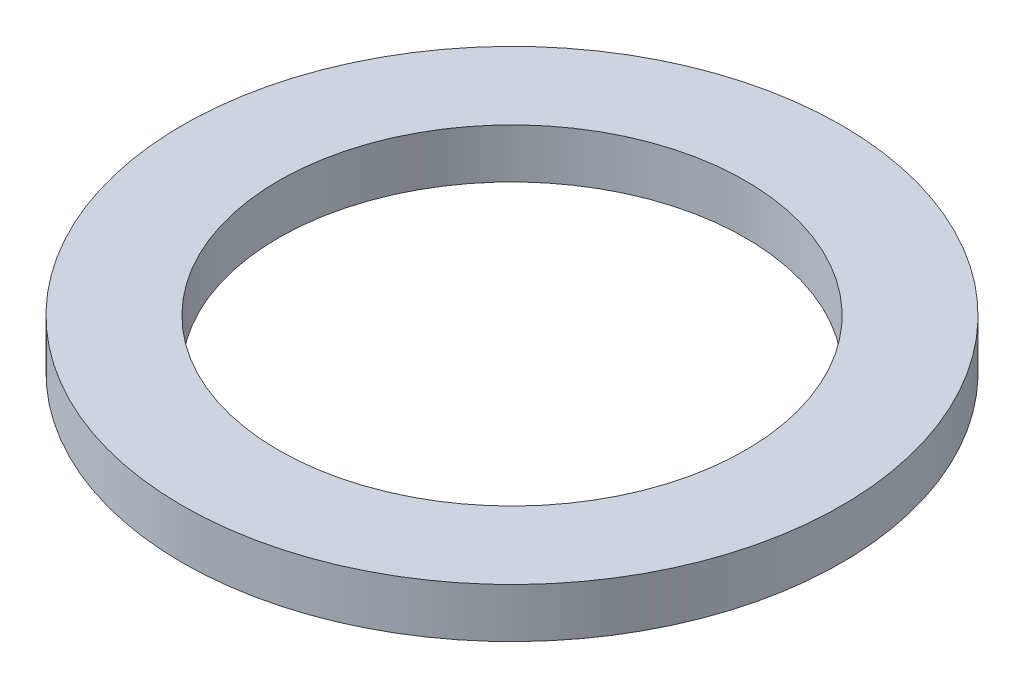
from build123d import *

# Parameters (mm, degrees)
SKETCH1_R           = 60
BOSS_EXTRUDE1_DEPTH = 9
SKETCH2_R           = 42.5
CUT_EXTRUDE1_DEPTH  = 86.32877592


with BuildPart() as part:
    # Sketch1 → Boss-Extrude1 (new body)
    with BuildSketch(Plane(origin=(0, 0, 0), x_dir=(1, 0, 0), z_dir=(0, 1, 0))):
        Circle(SKETCH1_R)
    extrude(amount=BOSS_EXTRUDE1_DEPTH)

    # Sketch2 → Cut-Extrude1 (cut, through all)
    with BuildSketch(Plane(origin=(0, 0, 0), x_dir=(1, 0, 0), z_dir=(0, 1, 0))):
        Circle(SKETCH2_R)
    extrude(amount=CUT_EXTRUDE1_DEPTH, mode=Mode.SUBTRACT)


solid = part.part
